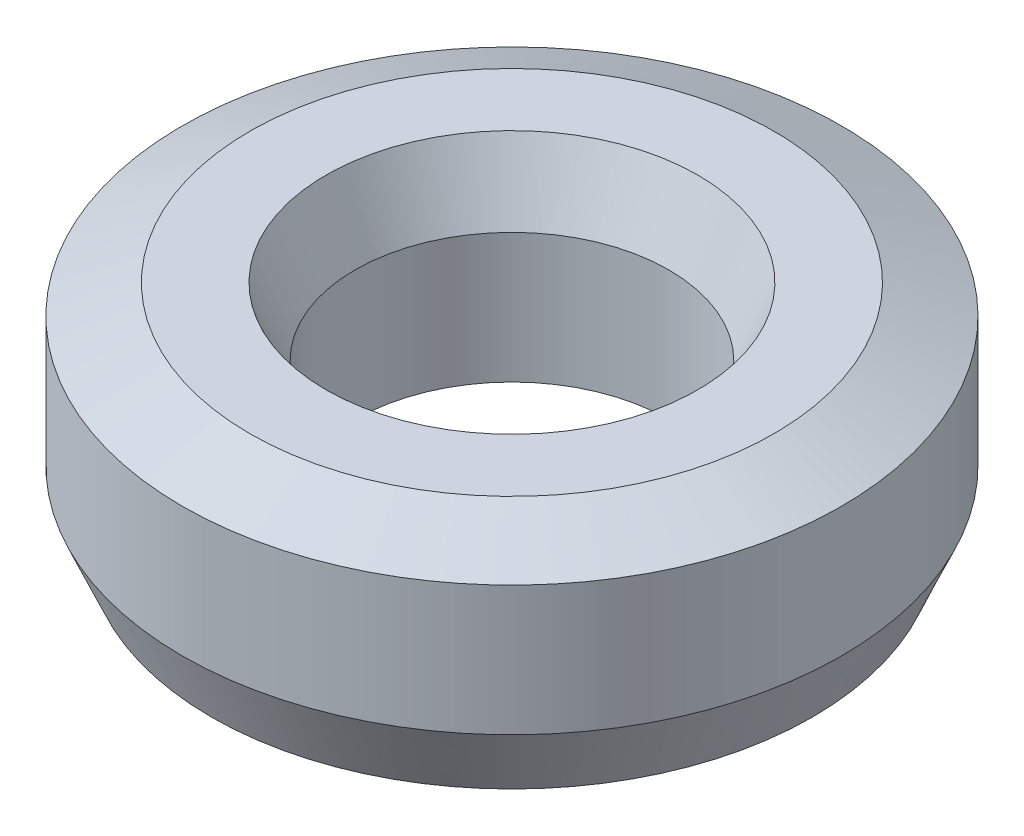
from build123d import *
from OCP.BRepFilletAPI import BRepFilletAPI_MakeChamfer

# Parameters (mm, degrees)
SKETCH1_R           = 7.5
BOSS_EXTRUDE1_DEPTH = 5.148869625
SKETCH2_R           = 3.570050992
CUT_EXTRUDE1_DEPTH  = 12.790286613
CHAMFER1_SIZE       = 0.6620479
CHAMFER1_SIZE2      = 1.536962844


with BuildPart() as part:
    # Sketch1 → Boss-Extrude1 (new body)
    with BuildSketch(Plane(origin=(0, 0, 0), x_dir=(1, 0, 0), z_dir=(0, 1, 0))):
        Circle(SKETCH1_R)
    extrude(amount=BOSS_EXTRUDE1_DEPTH)

    # Sketch2 → Cut-Extrude1 (cut, through all)
    with BuildSketch(Plane(origin=(0, 0, 0), x_dir=(1, 0, 0), z_dir=(0, 1, 0))):
        Circle(SKETCH2_R)
    extrude(amount=CUT_EXTRUDE1_DEPTH, mode=Mode.SUBTRACT)

    # Chamfer1: one chamfer whose edges measure the first distance from different faces: ONE call of the kernel's chamfer builder (chamfer() names one face for all edges)
    chamfer1_edges_1 = [part.edges().sort_by_distance(p)[0] for p in [
        (-3.570050992, 5.148869625, 0),
    ]]
    chamfer1_side_1 = [part.faces().sort_by_distance(p)[0] for p in [
        (-7.287867966, 5.148869625, 0),
    ]]
    chamfer1_edges_2 = [part.edges().sort_by_distance(p)[0] for p in [
        (-3.570050992, 0, 0),
    ]]
    chamfer1_side_2 = [part.faces().sort_by_distance(p)[0] for p in [
        (-3.570050992, 2.574434813, 0),
    ]]
    chamfer1_edges_3 = [part.edges().sort_by_distance(p)[0] for p in [
        (-7.5, 0, 0),
    ]]
    chamfer1_side_3 = [part.faces().sort_by_distance(p)[0] for p in [
        (-7.287867966, 0, 0),
    ]]
    chamfer1_edges_4 = [part.edges().sort_by_distance(p)[0] for p in [
        (-7.5, 5.148869625, 0),
    ]]
    chamfer1_side_4 = [part.faces().sort_by_distance(p)[0] for p in [
        (-7.5, 2.574434813, 0),
    ]]
    chamfer1 = BRepFilletAPI_MakeChamfer(part.part.solid().wrapped)
    for e in chamfer1_edges_1:
        chamfer1.Add(CHAMFER1_SIZE, CHAMFER1_SIZE2, e.wrapped, chamfer1_side_1[0].wrapped)  # the first distance lies on this face
    for e in chamfer1_edges_2:
        chamfer1.Add(CHAMFER1_SIZE, CHAMFER1_SIZE2, e.wrapped, chamfer1_side_2[0].wrapped)  # the first distance lies on this face
    for e in chamfer1_edges_3:
        chamfer1.Add(CHAMFER1_SIZE, CHAMFER1_SIZE2, e.wrapped, chamfer1_side_3[0].wrapped)  # the first distance lies on this face
    for e in chamfer1_edges_4:
        chamfer1.Add(CHAMFER1_SIZE, CHAMFER1_SIZE2, e.wrapped, chamfer1_side_4[0].wrapped)  # the first distance lies on this face
    add(Compound.cast(chamfer1.Shape()), mode=Mode.REPLACE)


solid = part.part
